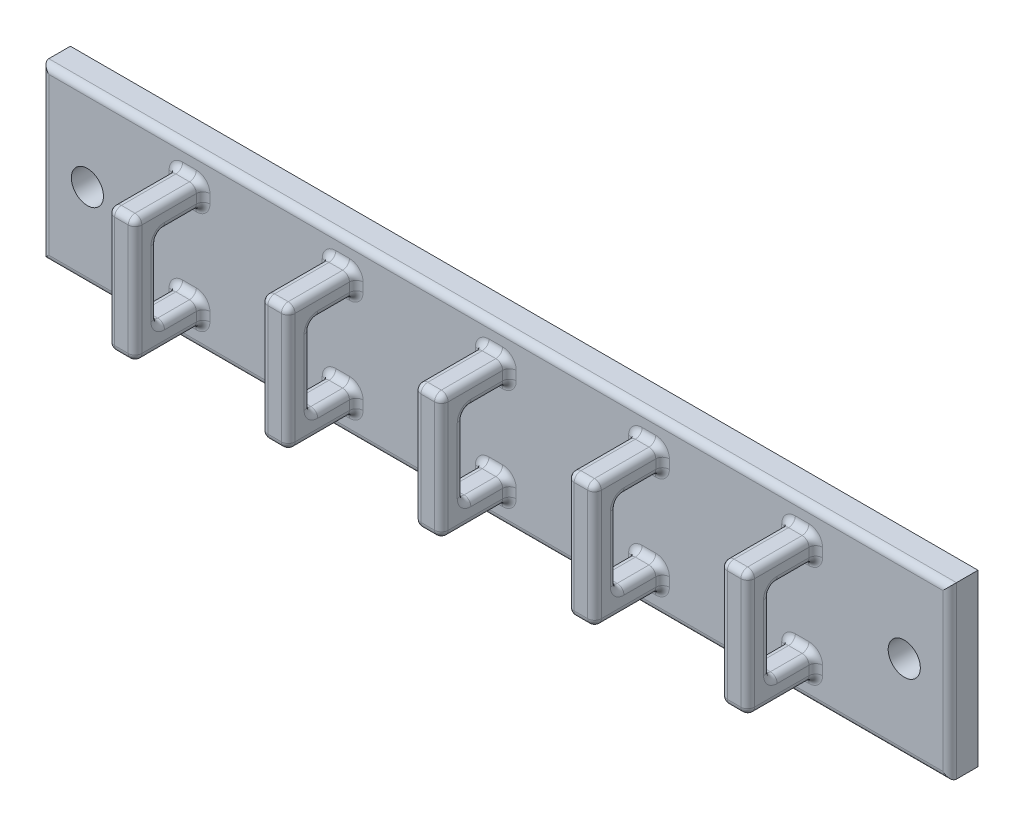
from build123d import *

# Parameters (mm, degrees)
SKETCH2_W              = 101.6
SKETCH2_H              = 19.05
BOSS_EXTRUDE1_DEPTH    = 3.175
M3_CLEARANCE_HOLE1_D   = 3.6
BOSS_EXTRUDE3_DEPTH    = 1.524
FILLET2_R              = 0.762
LPATTERN2_COUNT        = 5
LPATTERN2_PITCH        = 17.145
FILLET2_OF_LPATTERN2_R = 0.762
FILLET3_R              = 0.762


with BuildPart() as part:
    # Sketch2 → Boss-Extrude1 (new body)
    with BuildSketch(Plane.XY):
        with Locations((50.8, 9.525)):
            Rectangle(SKETCH2_W, SKETCH2_H)
    extrude(amount=BOSS_EXTRUDE1_DEPTH)

    # M3 Clearance Hole1 (through all)
    with Locations(Plane.XY.offset(3.175)):
        with Locations((5.08, 9.525), (96.52, 9.525)):
            Hole(M3_CLEARANCE_HOLE1_D / 2)

    # Sketch6 → Boss-Extrude3 (add, symmetric)
    with BuildSketch(Plane.ZY.offset(-16.51)):
        Polygon((3.175, 16.51), (10.795, 16.51), (10.795, 2.54), (3.175, 2.54), (3.175, 5.08), (8.255, 5.08), (8.255, 13.97), (3.175, 13.97), align=None)
    boss_extrude3 = extrude(amount=BOSS_EXTRUDE3_DEPTH, both=True)

    # Fillet2
    fillet2_edges = [part.edges().sort_by_distance(p)[0] for p in [
        (16.51, 16.51, 3.175),
        (16.51, 2.54, 3.175),
        (16.51, 5.08, 3.175),
        (16.51, 13.97, 3.175),
        (16.51, 13.97, 8.255),
        (16.51, 5.08, 8.255),
        (18.034, 13.97, 5.715),
        (18.034, 9.525, 8.255),
        (18.034, 5.08, 5.715),
        (18.034, 3.81, 3.175),
        (18.034, 2.54, 6.985),
        (18.034, 9.525, 10.795),
        (18.034, 16.51, 6.985),
        (18.034, 15.24, 3.175),
        (14.986, 16.51, 6.985),
        (14.986, 9.525, 10.795),
        (14.986, 2.54, 6.985),
        (14.986, 3.81, 3.175),
        (14.986, 5.08, 5.715),
        (14.986, 9.525, 8.255),
        (14.986, 13.97, 5.715),
        (14.986, 15.24, 3.175),
        (16.51, 2.54, 10.795),
        (16.51, 16.51, 10.795),
    ]]
    fillet(fillet2_edges, radius=FILLET2_R)

    # LPattern2: Boss-Extrude3 ×5
    with Locations(*[(i * LPATTERN2_PITCH, 0, 0) for i in range(1, LPATTERN2_COUNT)]):
        add(boss_extrude3)

    # Fillet2 of LPattern2
    fillet2_of_lpattern2_edges = [part.edges().sort_by_distance(p)[0] for p in [
        (33.655, 16.51, 3.175),
        (33.655, 2.54, 3.175),
        (33.655, 5.08, 3.175),
        (33.655, 13.97, 3.175),
        (33.655, 13.97, 8.255),
        (33.655, 5.08, 8.255),
        (35.179, 13.97, 5.715),
        (35.179, 9.525, 8.255),
        (35.179, 5.08, 5.715),
        (35.179, 3.81, 3.175),
        (35.179, 2.54, 6.985),
        (35.179, 9.525, 10.795),
        (35.179, 16.51, 6.985),
        (35.179, 15.24, 3.175),
        (32.131, 16.51, 6.985),
        (32.131, 9.525, 10.795),
        (32.131, 2.54, 6.985),
        (32.131, 3.81, 3.175),
        (32.131, 5.08, 5.715),
        (32.131, 9.525, 8.255),
        (32.131, 13.97, 5.715),
        (32.131, 15.24, 3.175),
        (33.655, 2.54, 10.795),
        (33.655, 16.51, 10.795),
        (50.8, 16.51, 3.175),
        (50.8, 2.54, 3.175),
        (50.8, 5.08, 3.175),
        (50.8, 13.97, 3.175),
        (50.8, 13.97, 8.255),
        (50.8, 5.08, 8.255),
        (52.324, 13.97, 5.715),
        (52.324, 9.525, 8.255),
        (52.324, 5.08, 5.715),
        (52.324, 3.81, 3.175),
        (52.324, 2.54, 6.985),
        (52.324, 9.525, 10.795),
        (52.324, 16.51, 6.985),
        (52.324, 15.24, 3.175),
        (49.276, 16.51, 6.985),
        (49.276, 9.525, 10.795),
        (49.276, 2.54, 6.985),
        (49.276, 3.81, 3.175),
        (49.276, 5.08, 5.715),
        (49.276, 9.525, 8.255),
        (49.276, 13.97, 5.715),
        (49.276, 15.24, 3.175),
        (50.8, 2.54, 10.795),
        (50.8, 16.51, 10.795),
        (67.945, 16.51, 3.175),
        (67.945, 2.54, 3.175),
        (67.945, 5.08, 3.175),
        (67.945, 13.97, 3.175),
        (67.945, 13.97, 8.255),
        (67.945, 5.08, 8.255),
        (69.469, 13.97, 5.715),
        (69.469, 9.525, 8.255),
        (69.469, 5.08, 5.715),
        (69.469, 3.81, 3.175),
        (69.469, 2.54, 6.985),
        (69.469, 9.525, 10.795),
        (69.469, 16.51, 6.985),
        (69.469, 15.24, 3.175),
        (66.421, 16.51, 6.985),
        (66.421, 9.525, 10.795),
        (66.421, 2.54, 6.985),
        (66.421, 3.81, 3.175),
        (66.421, 5.08, 5.715),
        (66.421, 9.525, 8.255),
        (66.421, 13.97, 5.715),
        (66.421, 15.24, 3.175),
        (67.945, 2.54, 10.795),
        (67.945, 16.51, 10.795),
        (85.09, 16.51, 3.175),
        (85.09, 2.54, 3.175),
        (85.09, 5.08, 3.175),
        (85.09, 13.97, 3.175),
        (85.09, 13.97, 8.255),
        (85.09, 5.08, 8.255),
        (86.614, 13.97, 5.715),
        (86.614, 9.525, 8.255),
        (86.614, 5.08, 5.715),
        (86.614, 3.81, 3.175),
        (86.614, 2.54, 6.985),
        (86.614, 9.525, 10.795),
        (86.614, 16.51, 6.985),
        (86.614, 15.24, 3.175),
        (83.566, 16.51, 6.985),
        (83.566, 9.525, 10.795),
        (83.566, 2.54, 6.985),
        (83.566, 3.81, 3.175),
        (83.566, 5.08, 5.715),
        (83.566, 9.525, 8.255),
        (83.566, 13.97, 5.715),
        (83.566, 15.24, 3.175),
        (85.09, 2.54, 10.795),
        (85.09, 16.51, 10.795),
    ]]
    fillet(fillet2_of_lpattern2_edges, radius=FILLET2_OF_LPATTERN2_R)

    # Fillet3
    fillet3_edges = [part.edges().sort_by_distance(p)[0] for p in [
        (101.6, 9.525, 3.175),
        (50.8, 0, 3.175),
        (0, 9.525, 3.175),
        (50.8, 19.05, 3.175),
    ]]
    fillet(fillet3_edges, radius=FILLET3_R)


solid = part.part
